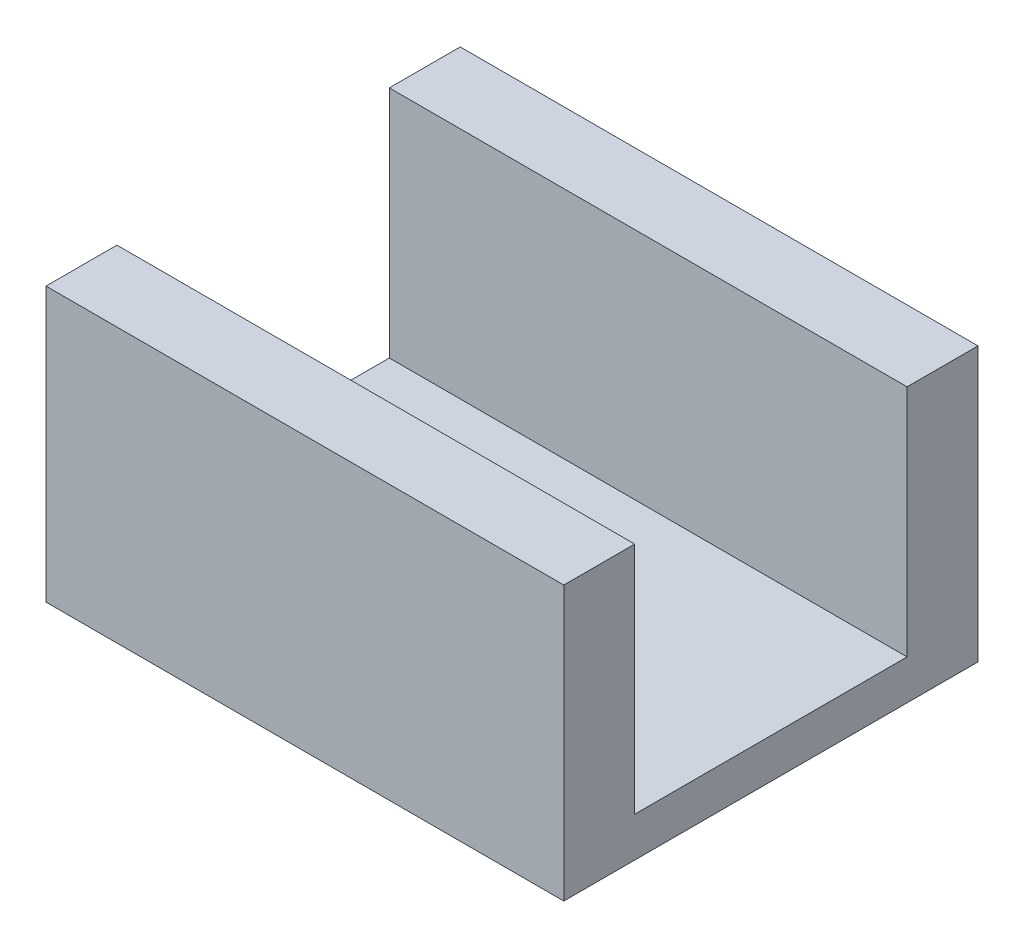
from build123d import *

# Parameters (mm, degrees)
BOSS_EXTRUDE1_DEPTH = 25


with BuildPart() as part:
    # Sketch2 → Boss-Extrude1 (new, symmetric)
    with BuildSketch(Plane(origin=(0, 0, 0), x_dir=(0, 0, -1), z_dir=(1, 0, 0))):
        Polygon((13.151258101, 13.215460733), (20, 13.215460733), (20, -13.215460733), (-20, -13.215460733), (-20, 13.215460733), (-13.151258101, 13.215460733), (-13.151258101, -9.374367393), (13.151258101, -9.374367393), align=None)
    extrude(amount=BOSS_EXTRUDE1_DEPTH, both=True)


solid = part.part
